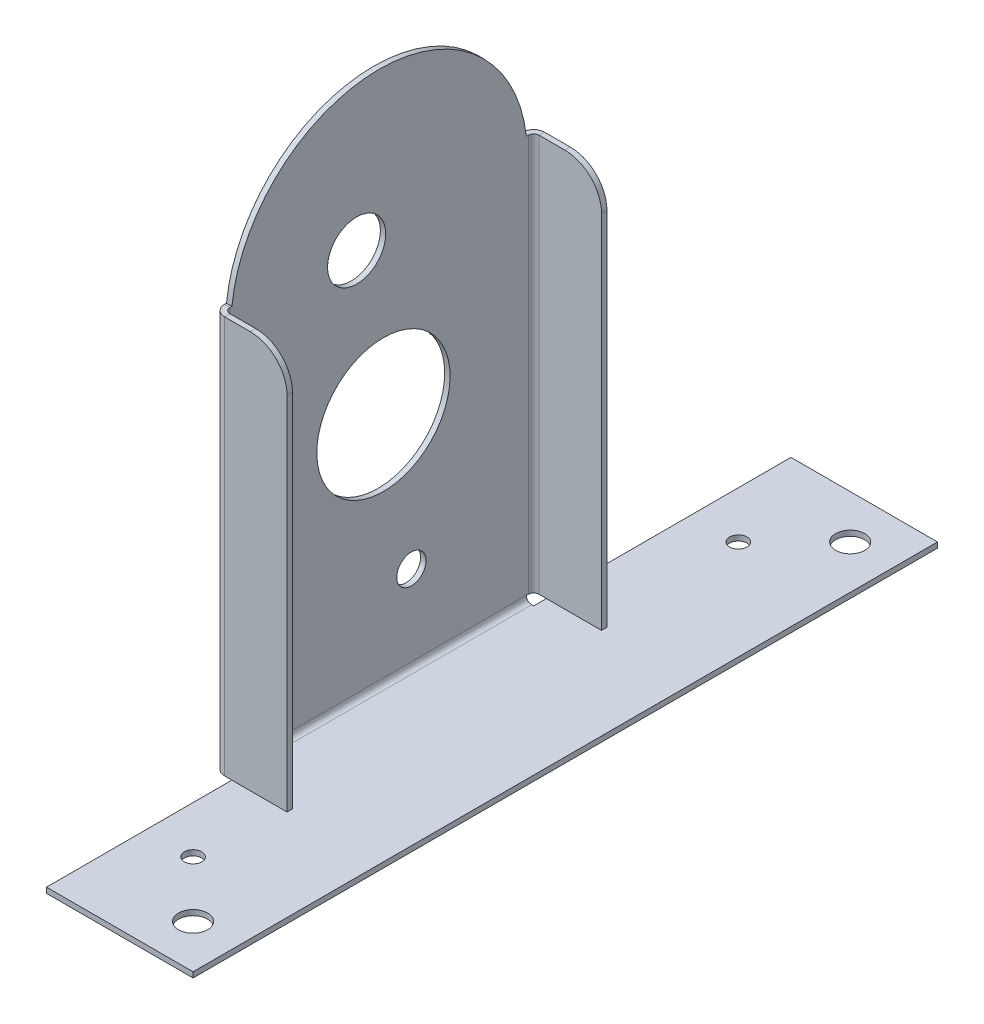
from build123d import *

# Parameters (mm, degrees)
SKETCH1_W                 = 20
SKETCH1_H                 = 101.6
BASE_FLANGE1_DEPTH        = 0.7366
EDGE_FLANGE1_DEPTH        = 40.191036667
EDGE_FLANGE1_START        = 0.7366
EDGE_FLANGE1_FLAT_DEPTH   = 0.7366
CUT_EXTRUDE1_DEPTH        = 235.985755194
CUT_EXTRUDE1_DEPTH_BACK   = 235.985755194
SKETCH9_R                 = 2
CUT_EXTRUDE3_DEPTH        = 238.044873218
CUT_EXTRUDE3_DEPTH_BACK   = 238.044873218
SKETCH11_R                = 3.96875
CUT_EXTRUDE5_DEPTH        = 196.726274862
CUT_EXTRUDE5_DEPTH_BACK   = 196.726274862
SKETCH13_R                = 1.984375
SKETCH13_R_2              = 1.190625
EDGE_FLANGE2_DEPTH        = 54.2634
EDGE_FLANGE2_START        = 0.7366
EDGE_FLANGE2_FLAT_DEPTH   = 0.7366
EDGE_FLANGE2_BEND_DEPTH   = 54.2634
EDGE_FLANGE2_FLAT_2_DEPTH = 0.7366
SKETCH30_R                = 9.089973339
CUT_EXTRUDE15_DEPTH       = 10


# Sheet-metal steps are written as plain solids
with BuildPart() as part:
    # Sketch1 → Base-Flange1 (new body)
    with BuildSketch(Plane(origin=(0, 0, 0), x_dir=(1, 0, 0), z_dir=(0, 1, 0))):
        Rectangle(SKETCH1_W, SKETCH1_H)
    extrude(amount=-BASE_FLANGE1_DEPTH)

    # Edge-Flange1 bend section (across the edge) → Edge-Flange1 (add)
    with BuildSketch(Plane(origin=(-11, 0, -15.686713846), x_dir=(1, 0, 0), z_dir=(0, 0, 1))):
        with BuildLine():
            Line((-0.7366, 0.7366), (0, 0.7366))
            ThreePointArc((0, 0.7366), (0.215745145, 0.215745145), (0.7366, 0))
            Line((0.7366, 0), (1, 0))
            Line((1, 0), (1, -0.7366))
            Line((1, -0.7366), (0.7366, -0.7366))
            ThreePointArc((0.7366, -0.7366), (-0.30510971, -0.30510971), (-0.7366, 0.7366))
        make_face()
    extrude(amount=EDGE_FLANGE1_DEPTH)

    # Edge-Flange1 profile (on flange) → Edge-Flange1 flat (add)
    with BuildSketch(Plane.ZY.offset(11).offset(EDGE_FLANGE1_START)):
        with BuildLine():
            ThreePointArc((24.504322822, 55), (4.408804488, 72.976240445), (-15.686713846, 55))
            Line((-15.686713846, 55), (-15.686713846, 0.7366))
            Line((-15.686713846, 0.7366), (24.504322822, 0.7366))
            Line((24.504322822, 0.7366), (24.504322822, 55))
        make_face()
    extrude(amount=-EDGE_FLANGE1_FLAT_DEPTH)

    # Sketch9 → Cut-Extrude1 (cut, two sides: drawn at the far end of the back side and taken through both)
    with BuildSketch(Plane(origin=(-32.365, -124.793980752, 68.826299478), x_dir=(0, 0, -1), z_dir=(1, 0, 0)).offset(-CUT_EXTRUDE1_DEPTH_BACK)):
        with Locations(Location((68.826299478, 136.507533033, 0), (0, 0, 270))):
            Circle(SKETCH9_R)
    extrude(amount=CUT_EXTRUDE1_DEPTH + CUT_EXTRUDE1_DEPTH_BACK, mode=Mode.SUBTRACT)

    # Sketch11 → Cut-Extrude3 (cut, two sides: drawn at the far end of the back side and taken through both)
    with BuildSketch(Plane(origin=(-42.6, -124.793980752, 68.826299478), x_dir=(0, 0, -1), z_dir=(1, 0, 0)).offset(-CUT_EXTRUDE3_DEPTH_BACK)):
        with Locations(Location((61.354566786, 177.878571708, 0), (0, 0, 270))):
            Circle(SKETCH11_R)
    extrude(amount=CUT_EXTRUDE3_DEPTH + CUT_EXTRUDE3_DEPTH_BACK, mode=Mode.SUBTRACT)

    # Sketch13 → Cut-Extrude5 (cut, two sides: drawn at the far end of the back side and taken through both)
    with BuildSketch(Plane(origin=(124.911822879, 0, 68.826299478), x_dir=(-0.7071067811865436, 0, 0.7071067811865515), z_dir=(0, 1, 0)).offset(-CUT_EXTRUDE5_DEPTH_BACK)):
        with Locations(Location((68.508410595, -102.424928038, 0), (0, 0, 45))):
            Circle(SKETCH13_R)
        with Locations(Location((68.508410595, -113.219195896, 0), (0, 0, 45))):
            Circle(SKETCH13_R_2)
        with Locations(Location((5.089841868, -165.843496765, 0), (0, 0, 45))):
            Circle(SKETCH13_R)
        with Locations(Location((15.884109726, -165.843496765, 0), (0, 0, 45))):
            Circle(SKETCH13_R_2)
    extrude(amount=CUT_EXTRUDE5_DEPTH + CUT_EXTRUDE5_DEPTH_BACK, mode=Mode.SUBTRACT)

    # Edge-Flange2 bend section (across the edge) → Edge-Flange2 (add)
    with BuildSketch(Plane(origin=(-11, 0.7366, -16.686713846), x_dir=(0, 0, 1), z_dir=(0, 1, 0))):
        with BuildLine():
            Line((-0.7366, 0.7366), (0, 0.7366))
            ThreePointArc((0, 0.7366), (0.215745145, 0.215745145), (0.7366, 0))
            Line((0.7366, 0), (1, 0))
            Line((1, 0), (1, -0.7366))
            Line((1, -0.7366), (0.7366, -0.7366))
            ThreePointArc((0.7366, -0.7366), (-0.30510971, -0.30510971), (-0.7366, 0.7366))
        make_face()
    extrude(amount=EDGE_FLANGE2_DEPTH)

    # Edge-Flange2 profile (on flange) → Edge-Flange2 flat (add)
    with BuildSketch(Plane(origin=(-11, 0, -16.686713846), x_dir=(0, 1, 0), z_dir=(0, 0, -1)).offset(EDGE_FLANGE2_START)):
        with BuildLine():
            Line((50, 9.2634), (0.7366, 9.2634))
            Line((0.7366, 9.2634), (0.7366, 0.7366))
            Line((0.7366, 0.7366), (55, 0.7366))
            Line((55, 0.7366), (55, 4.2634))
            ThreePointArc((55, 4.2634), (53.535533906, 7.798933906), (50, 9.2634))
        make_face()
    extrude(amount=-EDGE_FLANGE2_FLAT_DEPTH)

    # Edge-Flange2 bend section 2 (across the edge) → Edge-Flange2 bend (add)
    with BuildSketch(Plane(origin=(-11, 55, 25.504322822), x_dir=(0, 0, -1), z_dir=(0, -1, 0))):
        with BuildLine():
            Line((-0.7366, 0.7366), (0, 0.7366))
            ThreePointArc((0, 0.7366), (0.215745145, 0.215745145), (0.7366, 0))
            Line((0.7366, 0), (1, 0))
            Line((1, 0), (1, -0.7366))
            Line((1, -0.7366), (0.7366, -0.7366))
            ThreePointArc((0.7366, -0.7366), (-0.30510971, -0.30510971), (-0.7366, 0.7366))
        make_face()
    extrude(amount=EDGE_FLANGE2_BEND_DEPTH)

    # Edge-Flange2 profile 2 (on flange) → Edge-Flange2 flat 2 (add)
    with BuildSketch(Plane(origin=(-11, 0, 25.504322822), x_dir=(0, -1, 0), z_dir=(0, 0, 1)).offset(EDGE_FLANGE2_START)):
        with BuildLine():
            ThreePointArc((-50, 9.2634), (-53.535533906, 7.798933906), (-55, 4.2634))
            Line((-55, 4.2634), (-55, 0.7366))
            Line((-55, 0.7366), (-0.7366, 0.7366))
            Line((-0.7366, 0.7366), (-0.7366, 9.2634))
            Line((-0.7366, 9.2634), (-50, 9.2634))
        make_face()
    extrude(amount=-EDGE_FLANGE2_FLAT_2_DEPTH)

    # Sketch30 → Cut-Extrude15 (cut)
    with BuildSketch(Plane(origin=(-11, 0, 0), x_dir=(0, 0, -1), z_dir=(1, 0, 0))):
        with Locations(Location((-3.816431775, 31.863348386, 0), (0, 0, 90))):
            Circle(SKETCH30_R)
    extrude(amount=-CUT_EXTRUDE15_DEPTH, mode=Mode.SUBTRACT)


solid = part.part
